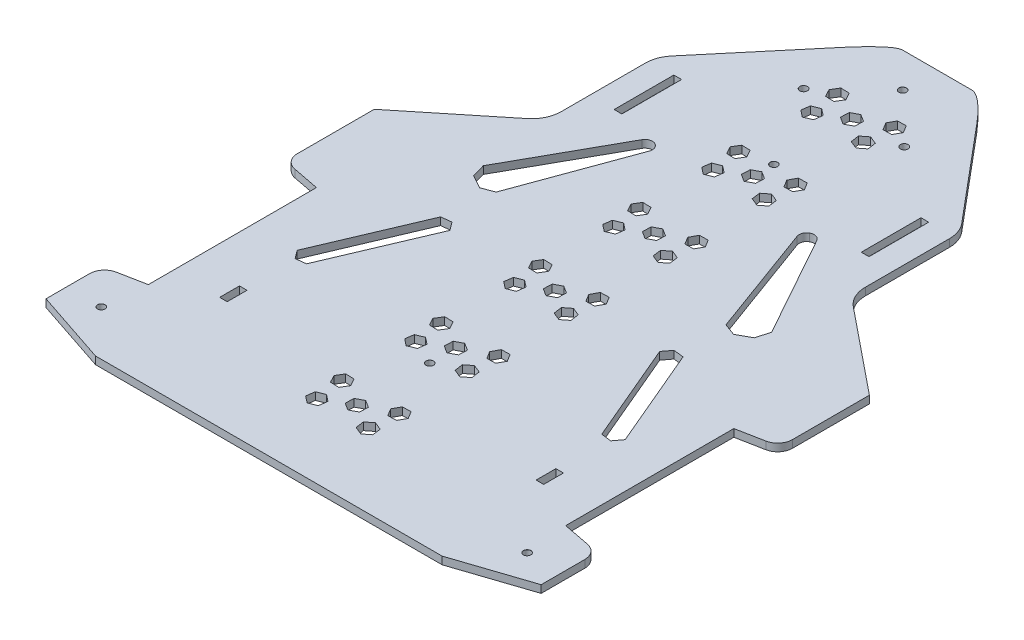
from build123d import *
from OCP.BRepFilletAPI import BRepFilletAPI_MakeChamfer

# Parameters (mm, degrees)
BOSS_EXTRUDE1_DEPTH             = 3.06
FILLET1_R                       = 6
CUT_EXTRUDE1_DEPTH              = 5
CHAMFER1_SIZE                   = 10
CHAMFER1_SIZE2                  = 30
CUT_EXTRUDE2_DEPTH              = 5
F_3_0MM_DOWEL_HOLE1_D           = 3
F_3_0MM_DOWEL_HOLE1_CSINK_D     = 3.05
F_3_0MM_DOWEL_HOLE1_CSINK_ANGLE = 90
CUT_EXTRUDE3_REACH              = 170.031
SKETCH7_W                       = 3.12
SKETCH7_H                       = 24.12
MIRROR7_START                   = -65.433965065
MIRROR7_OUTLINE_W               = 3.06
MIRROR7_OUTLINE_H               = 8
MIRROR7_DEPTH                   = 3.05
MIRROR7_START_2                 = 62.383965065
MIRROR7_2_OUTLINE_W             = 3.06
MIRROR7_2_OUTLINE_H             = 8
MIRROR7_2_DEPTH                 = 3.05
F_3_0MM_DOWEL_HOLE6_OUTLINE_R   = 1.55
F_3_0MM_DOWEL_HOLE6_DEPTH       = 3.06


# Read off the part's stored shape, not the designer's step: Mirror7, Ø3.0mm Dowel Hole6
with BuildPart() as part:
    # Sketch1 → Boss-Extrude1 (new body)
    with BuildSketch(Plane(origin=(0, 0, 0), x_dir=(1, 0, 0), z_dir=(0, 1, 0))):
        with BuildLine():
            Line((17.704500221, 135), (-17.704500221, 135))
            Line((-17.704500221, 135), (-58.606590997, 86.254786373))
            ThreePointArc((-58.606590997, 86.254786373), (-60.690369129, 82.645576777), (-61.41405768, 78.541335057))
            Line((-61.41405768, 78.541335057), (-61.41405768, 44.541335057))
            ThreePointArc((-61.41405768, 44.541335057), (-62.583034268, 39.375201895), (-65.862212987, 35.215583519))
            Line((-65.862212987, 35.215583519), (-100, 7.571348668))
            Line((-100, 7.571348668), (-100, -28.428651332))
            Line((-100, -28.428651332), (-84.293965065, -31.481595258))
            Line((-84.293965065, -31.481595258), (-84.293965065, -99.375707406))
            Line((-84.293965065, -99.375707406), (-100, -102.428651332))
            Line((-100, -102.428651332), (-100, -135))
            Line((-100, -135), (100, -135))
            Line((100, -135), (100, -102.428651332))
            Line((100, -102.428651332), (84.293965065, -99.375707406))
            Line((84.293965065, -99.375707406), (84.293965065, -31.481595258))
            Line((84.293965065, -31.481595258), (100, -28.428651332))
            Line((100, -28.428651332), (100, 7.571348668))
            Line((100, 7.571348668), (65.862212987, 35.215583519))
            ThreePointArc((65.862212987, 35.215583519), (62.583034268, 39.375201895), (61.41405768, 44.541335057))
            Line((61.41405768, 44.541335057), (61.41405768, 78.541335057))
            ThreePointArc((61.41405768, 78.541335057), (60.690369129, 82.645576777), (58.606590997, 86.254786373))
            Line((58.606590997, 86.254786373), (17.704500221, 135))
        make_face()
    extrude(amount=BOSS_EXTRUDE1_DEPTH)

    # Fillet1
    fillet1_edges = [part.edges().sort_by_distance(p)[0] for p in [
        (100, 1.53, 28.428651332),
        (100, 1.53, 102.428651332),
        (-100, 1.53, 102.428651332),
        (-100, 1.53, 28.428651332),
    ]]
    fillet(fillet1_edges, radius=FILLET1_R)

    # Fillet2
    # an asymmetric fillet: 22, 17 mm, written as the material it takes off along each edge
    with BuildSketch(Plane(origin=(-17.704500221, -36.135666588, -135), x_dir=(-0.6427876096865434, 0, 0.7660444431189746), z_dir=(0, 1, 0))) as fillet2_piece_1:
        with BuildLine():
            Bezier((14.454266635, 0), (0, 0), (-2.398711113, 2.858672587), weights=[1, 0.906307787, 1])
            Line((-2.398711113, 2.858672587), (0, 0))
            Line((0, 0), (14.454266635, 0))
        make_face()
    extrude(amount=75.331333176, mode=Mode.SUBTRACT)

    # Fillet3
    # an asymmetric fillet: 22, 17 mm, written as the material it takes off along each edge
    with BuildSketch(Plane(origin=(17.704500221, -36.135666588, -135), x_dir=(-1, 0, 0), z_dir=(0, 1, 0))) as fillet3_piece_1:
        with BuildLine():
            Bezier((3.731732033, 0), (0, 0), (-9.2910235, 11.072610635), weights=[1, 0.906307787, 1])
            Line((-9.2910235, 11.072610635), (0, 0))
            Line((0, 0), (3.731732033, 0))
        make_face()
    extrude(amount=75.331333176, mode=Mode.SUBTRACT)

    # Sketch3 → Cut-Extrude1 (cut)
    with BuildSketch(Plane(origin=(0, 3.06, 0), x_dir=(1, 0, 0), z_dir=(0, 1, 0))):
        with BuildLine():
            ThreePointArc((29.832614369, 48.529946677), (29.844466137, 50.62501228), (31.224454071, 52.201423916))
            Line((31.224454071, 52.201423916), (31.256672527, 52.218818066))
            ThreePointArc((31.256672527, 52.218818066), (33.52194136, 52.458952434), (35.302856494, 51.038583228))
            Line((35.302856494, 51.038583228), (58.240222349, 9.850679485))
            Line((58.240222349, 9.850679485), (56.691732686, 4.409890961))
            Line((56.691732686, 4.409890961), (51.29731014, 1.405760324))
            Line((51.29731014, 1.405760324), (46.427163942, 3.215670026))
            Line((46.427163942, 3.215670026), (29.832614369, 48.529946677))
        make_face()
        with BuildLine():
            ThreePointArc((-35.302856494, 51.038583228), (-33.52194136, 52.458952434), (-31.256672527, 52.218818066))
            Line((-31.256672527, 52.218818066), (-31.224454071, 52.201423916))
            ThreePointArc((-31.224454071, 52.201423916), (-29.844466137, 50.62501228), (-29.832614369, 48.529946677))
            Line((-29.832614369, 48.529946677), (-46.427163942, 3.215670026))
            Line((-46.427163942, 3.215670026), (-51.29731014, 1.405760324))
            Line((-51.29731014, 1.405760324), (-56.691732686, 4.409890961))
            Line((-56.691732686, 4.409890961), (-58.240222349, 9.850679485))
            Line((-58.240222349, 9.850679485), (-35.302856494, 51.038583228))
        make_face()
        Polygon((13.095449388, 56.867904156), (13.570943217, 53.436591634), (10.83708632, 51.309145638), (7.627735594, 52.613012163), (7.152241764, 56.044324684), (9.886098661, 58.17177068), align=None)
        Polygon((8.084949603, 66.130801276), (9.74697074, 69.170157415), (13.210140936, 69.250482958), (15.011289995, 66.291452362), (13.349268857, 63.252096223), (9.886098661, 63.17177068), align=None)
        Polygon((-7.627735594, 52.613012163), (-7.152241764, 56.044324684), (-9.886098661, 58.17177068), (-13.095449388, 56.867904156), (-13.570943217, 53.436591634), (-10.83708632, 51.309145638), align=None)
        Polygon((-9.886098661, 23.17177068), (-8.084949603, 26.130801277), (-9.74697074, 29.170157415), (-13.210140936, 29.250482958), (-15.011289995, 26.291452362), (-13.349268857, 23.252096223), align=None)
        Polygon((-0.134769774, 17.077041931), (2.930343892, 18.6910674), (3.065113666, 22.152546435), (0.134769774, 24), (-2.930343892, 22.385974531), (-3.065113666, 18.924495496), align=None)
        Polygon((-7.627735594, -27.386987837), (-7.152241764, -23.955675316), (-9.886098661, -21.828229319), (-13.095449388, -23.132095844), (-13.570943217, -26.563408365), (-10.83708632, -28.690854362), align=None)
        Polygon((8.084949603, -53.869198723), (9.74697074, -50.829842584), (13.210140936, -50.749517042), (15.011289995, -53.708547638), (13.349268857, -56.747903777), (9.886098661, -56.828229319), align=None)
        Polygon((-0.134769774, -62.922958069), (2.930343892, -61.3089326), (3.065113666, -57.847453565), (0.134769774, -56), (-2.930343892, -57.614025469), (-3.065113666, -61.075504504), align=None)
        Polygon((-7.627735594, -67.386987837), (-7.152241764, -63.955675316), (-9.886098661, -61.828229319), (-13.095449388, -63.132095844), (-13.570943217, -66.563408365), (-10.83708632, -68.690854362), align=None)
        Polygon((-9.886098661, -56.828229319), (-8.084949603, -53.869198723), (-9.74697074, -50.829842584), (-13.210140936, -50.749517042), (-15.011289995, -53.708547638), (-13.349268857, -56.747903777), align=None)
        Polygon((8.084949603, -93.869198723), (9.74697074, -90.829842584), (13.210140936, -90.749517042), (15.011289995, -93.708547638), (13.349268857, -96.747903777), (9.886098661, -96.828229319), align=None)
        Polygon((13.095449388, -103.132095844), (13.570943217, -106.563408365), (10.83708632, -108.690854362), (7.627735594, -107.386987837), (7.152241764, -103.955675316), (9.886098661, -101.828229319), align=None)
        Polygon((-0.134769774, -102.922958069), (2.930343892, -101.308932599), (3.065113666, -97.847453565), (0.134769774, -95.999999999), (-2.930343892, -97.614025469), (-3.065113666, -101.075504504), align=None)
        Polygon((-7.627735594, -107.386987837), (-7.152241764, -103.955675316), (-9.886098661, -101.828229319), (-13.095449388, -103.132095844), (-13.570943217, -106.563408365), (-10.83708632, -108.690854362), align=None)
        Polygon((-9.886098661, -96.828229319), (-8.084949603, -93.869198723), (-9.74697074, -90.829842584), (-13.210140936, -90.749517042), (-15.011289995, -93.708547638), (-13.349268857, -96.747903777), align=None)
        Polygon((13.349268857, 103.252096223), (9.886098661, 103.17177068), (8.084949603, 106.130801276), (9.74697074, 109.170157415), (13.210140936, 109.250482958), (15.011289995, 106.291452362), align=None)
        Polygon((10.83708632, 91.309145638), (7.627735594, 92.613012163), (7.152241764, 96.044324684), (9.886098661, 98.17177068), (13.095449388, 96.867904155), (13.570943217, 93.436591634), align=None)
        Polygon((-13.095449388, 96.867904155), (-13.570943217, 93.436591634), (-10.83708632, 91.309145638), (-7.627735594, 92.613012163), (-7.152241764, 96.044324684), (-9.886098661, 98.17177068), align=None)
        Polygon((-3.065113666, 98.924495496), (-0.134769774, 97.07704193), (2.930343892, 98.6910674), (3.065113666, 102.152546435), (0.134769774, 104), (-2.930343892, 102.38597453), align=None)
        Polygon((-13.210140936, 109.250482958), (-15.011289995, 106.291452362), (-13.349268857, 103.252096223), (-9.886098661, 103.17177068), (-8.084949603, 106.130801276), (-9.74697074, 109.170157415), align=None)
        Polygon((2.930343892, 58.6910674), (3.065113666, 62.152546435), (0.134769774, 64), (-2.930343892, 62.385974531), (-3.065113666, 58.924495496), (-0.134769774, 57.077041931), align=None)
        Polygon((-9.886098661, 63.17177068), (-8.084949603, 66.130801276), (-9.74697074, 69.170157415), (-13.210140936, 69.250482958), (-15.011289995, 66.291452362), (-13.349268857, 63.252096223), align=None)
        Polygon((13.210140936, 29.250482958), (15.011289995, 26.291452362), (13.349268857, 23.252096223), (9.886098661, 23.17177068), (8.084949603, 26.130801277), (9.74697074, 29.170157415), align=None)
        Polygon((13.570943217, 13.436591634), (10.83708632, 11.309145638), (7.627735594, 12.613012163), (7.152241764, 16.044324684), (9.886098661, 18.17177068), (13.095449388, 16.867904156), align=None)
        Polygon((-7.152241764, 16.044324684), (-9.886098661, 18.17177068), (-13.095449388, 16.867904156), (-13.570943217, 13.436591634), (-10.83708632, 11.309145638), (-7.627735594, 12.613012163), align=None)
        Polygon((9.886098661, -16.828229319), (8.084949603, -13.869198723), (9.74697074, -10.829842585), (13.210140936, -10.749517042), (15.011289995, -13.708547638), (13.349268857, -16.747903777), align=None)
        Polygon((7.152241764, -23.955675316), (9.886098661, -21.828229319), (13.095449388, -23.132095844), (13.570943217, -26.563408365), (10.83708632, -28.690854362), (7.627735594, -27.386987837), align=None)
        Polygon((2.930343892, -21.3089326), (3.065113666, -17.847453565), (0.134769774, -16), (-2.930343892, -17.614025469), (-3.065113666, -21.075504504), (-0.134769774, -22.922958069), align=None)
        Polygon((-8.084949603, -13.869198723), (-9.74697074, -10.829842585), (-13.210140936, -10.749517042), (-15.011289995, -13.708547638), (-13.349268857, -16.747903777), (-9.886098661, -16.828229319), align=None)
        Polygon((13.095449388, -63.132095844), (13.570943217, -66.563408365), (10.83708632, -68.690854362), (7.627735594, -67.386987837), (7.152241764, -63.955675316), (9.886098661, -61.828229319), align=None)
    extrude(amount=-CUT_EXTRUDE1_DEPTH, mode=Mode.SUBTRACT)

    # Chamfer1: one chamfer whose edges measure the first distance from different faces: ONE call of the kernel's chamfer builder (chamfer() names one face for all edges)
    chamfer1_edges_1 = [part.edges().sort_by_distance(p)[0] for p in [
        (100, 1.53, 135),
    ]]
    chamfer1_side_1 = [part.faces().sort_by_distance(p)[0] for p in [
        (100, 1.53, 121.187334824),
    ]]
    chamfer1_edges_2 = [part.edges().sort_by_distance(p)[0] for p in [
        (-100, 1.53, 135),
    ]]
    chamfer1_side_2 = [part.faces().sort_by_distance(p)[0] for p in [
        (-100, 1.53, 121.187334824),
    ]]
    chamfer1 = BRepFilletAPI_MakeChamfer(part.part.solid().wrapped)
    for e in chamfer1_edges_1:
        chamfer1.Add(CHAMFER1_SIZE, CHAMFER1_SIZE2, e.wrapped, chamfer1_side_1[0].wrapped)  # the first distance lies on this face
    for e in chamfer1_edges_2:
        chamfer1.Add(CHAMFER1_SIZE, CHAMFER1_SIZE2, e.wrapped, chamfer1_side_2[0].wrapped)  # the first distance lies on this face
    add(Compound.cast(chamfer1.Shape()), mode=Mode.REPLACE)

    # Sketch5 → Cut-Extrude2 (cut)
    with BuildSketch(Plane(origin=(0, 3.06, 0), x_dir=(1, 0, 0), z_dir=(0, 1, 0))):
        Polygon((-57.982650762, -56.313592791), (-43.977644423, -23.319865472), (-48.103581295, -23.82646682), (-50.605279367, -20.506601347), (-64.610285707, -53.500328666), (-60.484348835, -52.993727319), align=None)
        with BuildLine():
            Line((-43.977644423, -23.319865472), (-43.165525023, -21.406632063))
            ThreePointArc((-43.165525023, -21.406632063), (-42.906176335, -19.561270481), (-43.604254517, -17.833466105))
            ThreePointArc((-43.604254517, -17.833466105), (-45.072710399, -16.686182542), (-46.918072294, -16.426833874))
            ThreePointArc((-46.918072294, -16.426833874), (-48.645876644, -17.124912213), (-49.793159967, -18.593367937))
            Line((-49.793159967, -18.593367937), (-50.605279367, -20.506601347))
            Line((-50.605279367, -20.506601347), (-48.103581295, -23.82646682))
            Line((-48.103581295, -23.82646682), (-43.977644423, -23.319865472))
        make_face()
        with BuildLine():
            Line((-58.794770162, -58.226826201), (-57.982650762, -56.313592791))
            Line((-57.982650762, -56.313592791), (-60.484348835, -52.993727319))
            Line((-60.484348835, -52.993727319), (-64.610285707, -53.500328666))
            Line((-64.610285707, -53.500328666), (-65.422405107, -55.413562076))
            ThreePointArc((-65.422405107, -55.413562076), (-65.681753757, -57.258923968), (-64.983675236, -58.986728533))
            ThreePointArc((-64.983675236, -58.986728533), (-63.515219558, -60.13401167), (-61.669858085, -60.393360295))
            ThreePointArc((-61.669858085, -60.393360295), (-59.942053586, -59.695282001), (-58.794770162, -58.226826201))
        make_face()
        with BuildLine():
            Line((-59.606889562, -60.14005961), (-58.794770162, -58.226826201))
            ThreePointArc((-58.794770162, -58.226826201), (-59.942053586, -59.695282001), (-61.669858085, -60.393360295))
            Line((-61.669858085, -60.393360295), (-59.606889562, -60.14005961))
        make_face()
        with BuildLine():
            Line((-63.732826435, -60.646660958), (-61.669858085, -60.393360295))
            ThreePointArc((-61.669858085, -60.393360295), (-63.515219558, -60.13401167), (-64.983675236, -58.986728533))
            Line((-64.983675236, -58.986728533), (-63.732826435, -60.646660958))
        make_face()
        with BuildLine():
            Line((-66.234524507, -57.326795485), (-64.983675236, -58.986728533))
            ThreePointArc((-64.983675236, -58.986728533), (-65.681753757, -57.258923968), (-65.422405107, -55.413562076))
            Line((-65.422405107, -55.413562076), (-66.234524507, -57.326795485))
        make_face()
        with BuildLine():
            ThreePointArc((-43.604254517, -17.833466105), (-42.906176335, -19.561270481), (-43.165525023, -21.406632063))
            Line((-43.165525023, -21.406632063), (-42.353405623, -19.493398653))
            Line((-42.353405623, -19.493398653), (-43.604254517, -17.833466105))
        make_face()
        with BuildLine():
            ThreePointArc((-46.918072294, -16.426833874), (-45.072710399, -16.686182542), (-43.604254517, -17.833466105))
            Line((-43.604254517, -17.833466105), (-44.855103695, -16.17353318))
            Line((-44.855103695, -16.17353318), (-46.918072294, -16.426833874))
        make_face()
        with BuildLine():
            ThreePointArc((-49.793159967, -18.593367937), (-48.645876644, -17.124912213), (-46.918072294, -16.426833874))
            Line((-46.918072294, -16.426833874), (-48.981040568, -16.680134528))
            Line((-48.981040568, -16.680134528), (-49.793159967, -18.593367937))
        make_face()
    cut_extrude2 = extrude(amount=-CUT_EXTRUDE2_DEPTH, mode=Mode.SUBTRACT)

    # Mirror4: Cut-Extrude2 across plane
    add(cut_extrude2.mirror(Plane(origin=(0, 0, 0), x_dir=(0, 0, 1), z_dir=(1, 0, 0))), mode=Mode.SUBTRACT)

    # Ø3.0mm Dowel Hole1 (through all)
    with Locations(Plane(origin=(86, 3.06, 116.654243634), x_dir=(0, 0, 1), z_dir=(0, 1, 0))):
        with Locations((0, 0), (-237.654243634, -86)):
            f_3_0mm_dowel_hole1 = CounterSinkHole(F_3_0MM_DOWEL_HOLE1_D / 2, F_3_0MM_DOWEL_HOLE1_CSINK_D / 2, counter_sink_angle=F_3_0MM_DOWEL_HOLE1_CSINK_ANGLE)

    # Mirror5: Ø3.0mm Dowel Hole1 across plane
    add(f_3_0mm_dowel_hole1.mirror(Plane(origin=(0, 0, 0), x_dir=(0, 0, 1), z_dir=(1, 0, 0))), mode=Mode.SUBTRACT)

    # Sketch7 → Cut-Extrude3 (cut, up to next)
    with BuildSketch(Plane.XZ, mode=Mode.PRIVATE) as cut_extrude3_sk1:
        with Locations((49.91405768, -68)):
            Rectangle(SKETCH7_W, SKETCH7_H)
    cut_extrude3_tool1 = extrude(cut_extrude3_sk1.sketch, amount=-CUT_EXTRUDE3_REACH, mode=Mode.PRIVATE) & part.part
    cut_extrude3 = cut_extrude3_tool1.solids().sort_by_distance((49.914058, 0, -68))[0]
    add(cut_extrude3, mode=Mode.SUBTRACT)

    # Mirror6: Cut-Extrude3 across plane
    add(cut_extrude3.mirror(Plane(origin=(0, 0, 0), x_dir=(0, 0, 1), z_dir=(1, 0, 0))), mode=Mode.SUBTRACT)

    # Mirror7 outline → Mirror7 (cut)
    with BuildSketch(Plane.YZ.offset(MIRROR7_START)):
        with Locations((1.53, 85.428651332)):
            Rectangle(MIRROR7_OUTLINE_W, MIRROR7_OUTLINE_H)
    extrude(amount=MIRROR7_DEPTH, mode=Mode.SUBTRACT)

    # Mirror7 2 outline → Mirror7 2 (cut)
    with BuildSketch(Plane.YZ.offset(MIRROR7_START_2)):
        with Locations((1.53, 85.428651332)):
            Rectangle(MIRROR7_2_OUTLINE_W, MIRROR7_2_OUTLINE_H)
    extrude(amount=MIRROR7_2_DEPTH, mode=Mode.SUBTRACT)

    # Ø3.0mm Dowel Hole6 outline → Ø3.0mm Dowel Hole6 (cut)
    with BuildSketch(Plane(origin=(0, 0, 0), x_dir=(1, 0, 0), z_dir=(0, 1, 0))):
        with Locations((-20.503494055, 101.5)):
            Circle(F_3_0MM_DOWEL_HOLE6_OUTLINE_R)
        with Locations((20.138291871, 101.5)):
            Circle(F_3_0MM_DOWEL_HOLE6_OUTLINE_R)
    extrude(amount=F_3_0MM_DOWEL_HOLE6_DEPTH, mode=Mode.SUBTRACT)

    # 3.0mm Dowel Hole6 2 outline → 3.0mm Dowel Hole6 2 (revolve, cut)
    with BuildSketch(Plane.XY.offset(70)):
        Polygon((0, 0), (1.5, 0), (1.5, 3.035), (1.525, 3.06), (0, 3.06), align=None)
    revolve(axis=Axis((0, 0, 70), (0, 1, 0)), mode=Mode.SUBTRACT)

    # 3.0mm Dowel Hole6 3 outline → 3.0mm Dowel Hole6 3 (revolve, cut)
    with BuildSketch(Plane.XY.offset(-69)):
        Polygon((0, 0), (1.5, 0), (1.5, 3.035), (1.525, 3.06), (0, 3.06), align=None)
    revolve(axis=Axis((0, 0, -69), (0, 1, 0)), mode=Mode.SUBTRACT)


solid = part.part
